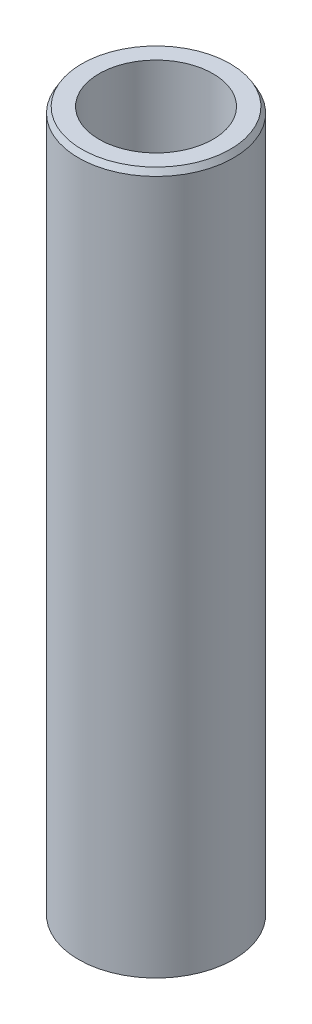
from build123d import *
from OCP.BRepFilletAPI import BRepFilletAPI_MakeChamfer

# Parameters (mm, degrees)
SKETCH1_R           = 32.5
BOSS_EXTRUDE1_DEPTH = 294.850621387
SKETCH2_R           = 23.872431715
CUT_EXTRUDE1_DEPTH  = 299.411442362
CHAMFER1_SIZE       = 2.417751374
CHAMFER1_SIZE2      = 1.395889407


with BuildPart() as part:
    # Sketch1 → Boss-Extrude1 (new body)
    with BuildSketch(Plane(origin=(0, 0, 0), x_dir=(1, 0, 0), z_dir=(0, 1, 0))):
        Circle(SKETCH1_R)
    extrude(amount=BOSS_EXTRUDE1_DEPTH)

    # Sketch2 → Cut-Extrude1 (cut, through all)
    with BuildSketch(Plane(origin=(0, 0, 0), x_dir=(1, 0, 0), z_dir=(0, 1, 0))):
        Circle(SKETCH2_R)
    extrude(amount=CUT_EXTRUDE1_DEPTH, mode=Mode.SUBTRACT)

    # Chamfer1: one chamfer whose edges measure the first distance from different faces: ONE call of the kernel's chamfer builder (chamfer() names one face for all edges)
    chamfer1_edges_1 = [part.edges().sort_by_distance(p)[0] for p in [
        (-32.5, 294.850621387, 0),
    ]]
    chamfer1_side_1 = [part.faces().sort_by_distance(p)[0] for p in [
        (-32.5, 147.425310694, 0),
    ]]
    chamfer1_edges_2 = [part.edges().sort_by_distance(p)[0] for p in [
        (-32.5, 0, 0),
    ]]
    chamfer1_side_2 = [part.faces().sort_by_distance(p)[0] for p in [
        (-31.580761184, 0, 0),
    ]]
    chamfer1 = BRepFilletAPI_MakeChamfer(part.part.solid().wrapped)
    for e in chamfer1_edges_1:
        chamfer1.Add(CHAMFER1_SIZE, CHAMFER1_SIZE2, e.wrapped, chamfer1_side_1[0].wrapped)  # the first distance lies on this face
    for e in chamfer1_edges_2:
        chamfer1.Add(CHAMFER1_SIZE, CHAMFER1_SIZE2, e.wrapped, chamfer1_side_2[0].wrapped)  # the first distance lies on this face
    add(Compound.cast(chamfer1.Shape()), mode=Mode.REPLACE)


solid = part.part
